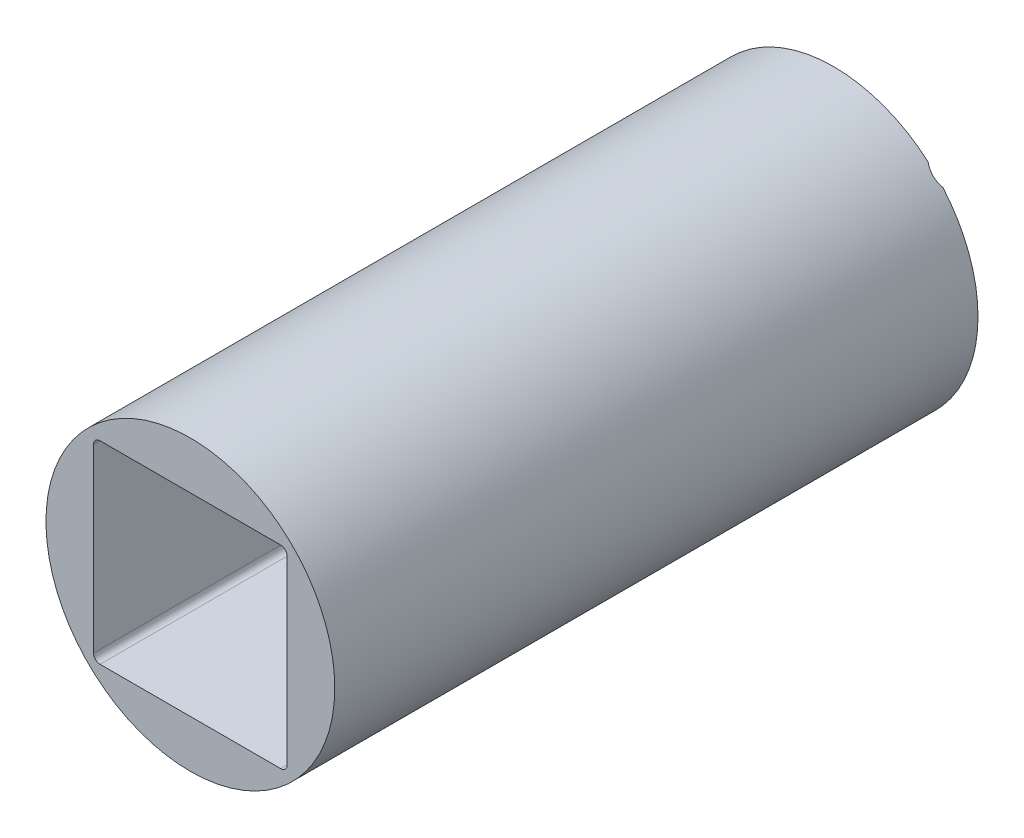
from build123d import *

# Parameters (mm, degrees)
SKIZZE1_R                       = 22.45
SKIZZE1_W                       = 30.1
SKIZZE1_H                       = 30.1
AUFSATZ_LINEAR_AUSTRAGEN1_DEPTH = 100
VERRUNDUNG1_R                   = 1
FASE1_SIZE                      = 2


with BuildPart() as part:
    # Skizze1 → Aufsatz-Linear austragen1 (new body)
    with BuildSketch(Plane.XY):
        Circle(SKIZZE1_R)
        Rectangle(SKIZZE1_W, SKIZZE1_H, mode=Mode.SUBTRACT)
    extrude(amount=AUFSATZ_LINEAR_AUSTRAGEN1_DEPTH)

    # Verrundung1
    verrundung1_edges = [part.edges().sort_by_distance(p)[0] for p in [
        (15.05, -15.05, 50),
        (15.05, 15.05, 50),
        (-15.05, 15.05, 50),
        (-15.05, -15.05, 50),
    ]]
    fillet(verrundung1_edges, radius=VERRUNDUNG1_R)

    # Fase1
    # the kernel refuses this chamfer: 2 mm, written as the material it takes off along each edge
    with BuildSketch(Plane(origin=(-15.05, -14.05, 0), x_dir=(-0.9996219169112968, 0, -0.02749587661058639), z_dir=(0, 1, 0)), Plane(origin=(14.05, -15.05, 0), x_dir=(0, -0.9996219169112968, -0.027495876610586424), z_dir=(-1, 0, 0)), Plane(origin=(15.05, 14.05, 0), x_dir=(0.9996219169112968, 0, -0.02749587661058639), z_dir=(0, -1, 0))) as fase1_piece_1:
        Polygon((FASE1_SIZE * 0.999621916911, FASE1_SIZE * 0.0274958766106), (-FASE1_SIZE * 0.0274958766106, FASE1_SIZE * 0.999621916911), (0, 0), align=None)
    extrude(amount=28.1, mode=Mode.SUBTRACT)
    with BuildSketch(Plane(origin=(-14.05, 15.05, 0), x_dir=(0, -0.027495876610586494, 0.9996219169112968), z_dir=(1, 0, 0))) as fase1_piece_2:
        Polygon((FASE1_SIZE * 0.999621916911, -FASE1_SIZE * 0.0274958766106), (-FASE1_SIZE * 0.0274958766106, -FASE1_SIZE * 0.999621916911), (0, 0), align=None)
    extrude(amount=28.1, mode=Mode.SUBTRACT)
    with BuildSketch(Plane(origin=(-14.05, -14.05, 0), x_dir=(0, -1, 0), z_dir=(1, 0, 0))) as fase1_piece_3:
        Polygon((1 + FASE1_SIZE, 0), (1, -FASE1_SIZE), (1, 0), align=None)
    revolve(axis=Axis((-14.05, -14.05, 0), (0, 0, -1)), revolution_arc=90, mode=Mode.SUBTRACT)
    with BuildSketch(Plane(origin=(14.05, -14.05, 0), x_dir=(1, 0, 0), z_dir=(0, 1, 0))) as fase1_piece_4:
        Polygon((1 + FASE1_SIZE, 0), (1, -FASE1_SIZE), (1, 0), align=None)
    revolve(axis=Axis((14.05, -14.05, 0), (0, 0, -1)), revolution_arc=90, mode=Mode.SUBTRACT)
    with BuildSketch(Plane(origin=(14.05, 14.05, 0), x_dir=(0, 1, 0), z_dir=(-1, 0, 0))) as fase1_piece_5:
        Polygon((1 + FASE1_SIZE, 0), (1, -FASE1_SIZE), (1, 0), align=None)
    revolve(axis=Axis((14.05, 14.05, 0), (0, 0, -1)), revolution_arc=90, mode=Mode.SUBTRACT)
    with BuildSketch(Plane(origin=(-14.05, 14.05, 0), x_dir=(0, 1, 0), z_dir=(1, 0, 0))) as fase1_piece_6:
        Polygon((1 + FASE1_SIZE, 0), (1, FASE1_SIZE), (1, 0), align=None)
    revolve(axis=Axis((-14.05, 14.05, 0), (0, 0, 1)), revolution_arc=90, mode=Mode.SUBTRACT)


solid = part.part
